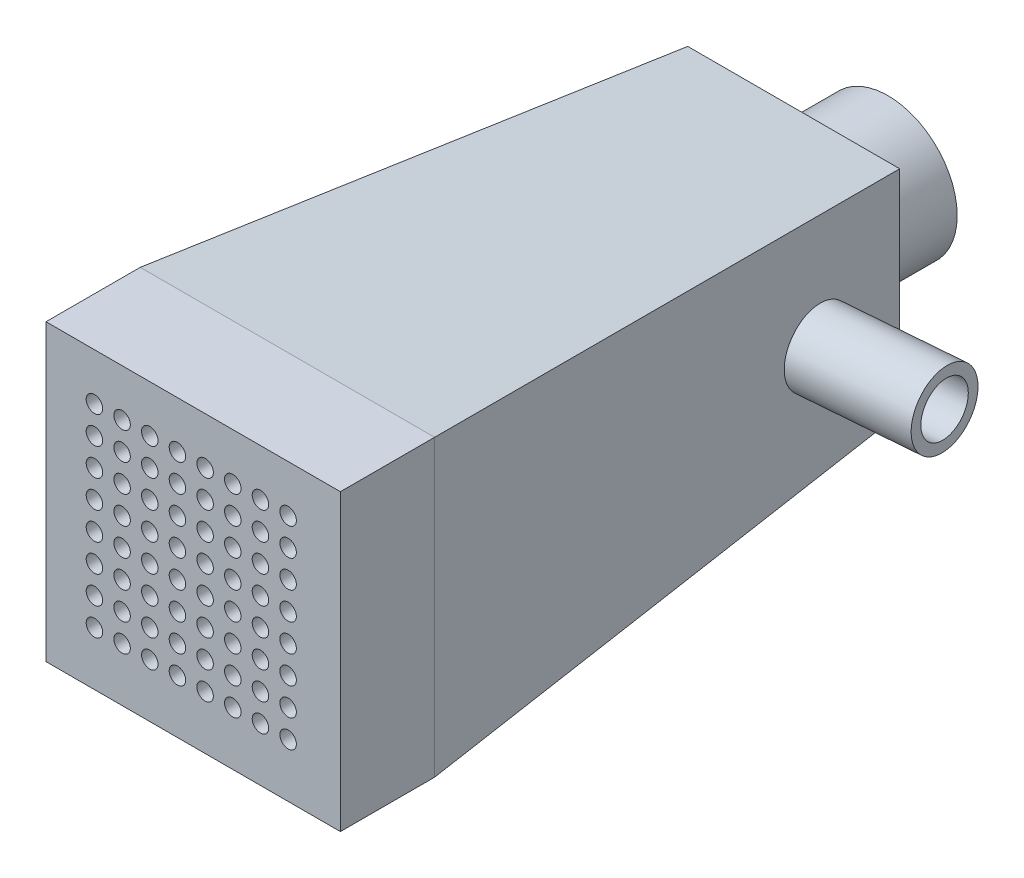
from build123d import *

# Parameters (mm, degrees)
SKETCH2_4_W         = 25
SKETCH2_4_H         = 25
BOSS_EXTRUDE2_DEPTH = 8
SKETCH5_R           = 0.7
CUT_EXTRUDE1_DEPTH  = 8
SKETCH6_R           = 3.1
SKETCH6_R_2         = 2.3
BOSS_EXTRUDE4_DEPTH = 10
CUT_EXTRUDE2_START  = -4
SKETCH6_4_R         = 2.3
CUT_EXTRUDE2_DEPTH  = 4
SKETCH9_R           = 3.1
SKETCH9_R_2         = 2.2
BOSS_EXTRUDE5_DEPTH = 10
SKETCH1_7_R         = 5.88
SKETCH1_7_R_2       = 4.38
BOSS_EXTRUDE7_DEPTH = 8
CUT_EXTRUDE3_START  = -20
SKETCH10_R          = 2.2
CUT_EXTRUDE3_DEPTH  = 20


with BuildPart() as part:
    # Sketch1 → Loft1 section 0
    with BuildSketch(Plane.XY):
        with BuildLine():
            Line((-9, 9), (9, 9))
            Line((9, 9), (9, -9))
            Line((9, -9), (-9, -9))
            Line((-9, -9), (-9, 9))
        make_face()
    # Sketch2 → Loft1 section 1
    with BuildSketch(Plane.XY.offset(43)):
        with BuildLine():
            Line((-12.5, 12.5), (12.5, 12.5))
            Line((12.5, 12.5), (12.5, -12.5))
            Line((12.5, -12.5), (-12.5, -12.5))
            Line((-12.5, -12.5), (-12.5, 12.5))
        make_face()
    loft()

    # Cut-Loft1: read off the stored shape, not the designer's step
    # Cut-Loft1: loft between two sections, ruled curve by curve
    cut_loft1_from = [
        Edge.make_bspline([(-3.097127702, -3.097127702, 0), (-2.732127702, -3.462127702, 0), (-2.271815958, -3.789394651, 0), (-1.207457606, -4.2500242, 0), (-0.604751801, -4.38, 0), (0.604751801, -4.38, 0), (1.207457606, -4.2500242, 0), (2.271815958, -3.789394651, 0), (2.732127702, -3.462127702, 0), (3.097127702, -3.097127702, 0)], [0, 0, 0, 0, 0.25, 0.25, 0.5, 0.5, 0.75, 0.75, 1, 1, 1, 1], 3),
        Edge.make_bspline([(3.097127702, -3.097127702, 0), (3.462127702, -2.732127702, 0), (3.789394651, -2.271815958, 0), (4.2500242, -1.207457606, 0), (4.38, -0.604751801, 0), (4.38, 0.604751801, 0), (4.2500242, 1.207457606, 0), (3.789394651, 2.271815958, 0), (3.462127702, 2.732127702, 0), (3.097127702, 3.097127702, 0)], [0, 0, 0, 0, 0.25, 0.25, 0.5, 0.5, 0.75, 0.75, 1, 1, 1, 1], 3),
        Edge.make_bspline([(-3.097127702, 3.097127702, 0), (-3.462127702, 2.732127702, 0), (-3.789394651, 2.271815958, 0), (-4.2500242, 1.207457606, 0), (-4.38, 0.604751801, 0), (-4.38, -0.604751801, 0), (-4.2500242, -1.207457606, 0), (-3.789394651, -2.271815958, 0), (-3.462127702, -2.732127702, 0), (-3.097127702, -3.097127702, 0)], [0, 0, 0, 0, 0.25, 0.25, 0.5, 0.5, 0.75, 0.75, 1, 1, 1, 1], 3),
        Edge.make_bspline([(3.097127702, 3.097127702, 0), (2.732127702, 3.462127702, 0), (2.271815958, 3.789394651, 0), (1.207457606, 4.2500242, 0), (0.604751801, 4.38, 0), (-0.604751801, 4.38, 0), (-1.207457606, 4.2500242, 0), (-2.271815958, 3.789394651, 0), (-2.732127702, 3.462127702, 0), (-3.097127702, 3.097127702, 0)], [0, 0, 0, 0, 0.25, 0.25, 0.5, 0.5, 0.75, 0.75, 1, 1, 1, 1], 3),
    ]
    cut_loft1_to = [
        Edge.make_bspline([(-10, -10, 43), (-8.333333333, -10, 43), (-6.666666667, -10, 43), (-3.333333333, -10, 43), (-1.666666667, -10, 43), (1.666666667, -10, 43), (3.333333333, -10, 43), (6.666666667, -10, 43), (8.333333333, -10, 43), (10, -10, 43)], [0, 0, 0, 0, 0.25, 0.25, 0.5, 0.5, 0.75, 0.75, 1, 1, 1, 1], 3),
        Edge.make_bspline([(10, -10, 43), (10, -8.333333333, 43), (10, -6.666666667, 43), (10, -3.333333333, 43), (10, -1.666666667, 43), (10, 1.666666667, 43), (10, 3.333333333, 43), (10, 6.666666667, 43), (10, 8.333333333, 43), (10, 10, 43)], [0, 0, 0, 0, 0.25, 0.25, 0.5, 0.5, 0.75, 0.75, 1, 1, 1, 1], 3),
        Edge.make_bspline([(-10, 10, 43), (-10, 8.333333333, 43), (-10, 6.666666667, 43), (-10, 3.333333333, 43), (-10, 1.666666667, 43), (-10, -1.666666667, 43), (-10, -3.333333333, 43), (-10, -6.666666667, 43), (-10, -8.333333333, 43), (-10, -10, 43)], [0, 0, 0, 0, 0.25, 0.25, 0.5, 0.5, 0.75, 0.75, 1, 1, 1, 1], 3),
        Edge.make_bspline([(10, 10, 43), (8.333333333, 10, 43), (6.666666667, 10, 43), (3.333333333, 10, 43), (1.666666667, 10, 43), (-1.666666667, 10, 43), (-3.333333333, 10, 43), (-6.666666667, 10, 43), (-8.333333333, 10, 43), (-10, 10, 43)], [0, 0, 0, 0, 0.25, 0.25, 0.5, 0.5, 0.75, 0.75, 1, 1, 1, 1], 3),
    ]
    cut_loft1 = Solid(Shell([*[Face.make_surface_from_curves(cut_loft1_from[k], cut_loft1_to[k]) for k in range(4)], Face(Wire(cut_loft1_from)), Face(Wire(cut_loft1_to))]))
    add(cut_loft1, mode=Mode.SUBTRACT)

    # Sketch2<4> → Boss-Extrude2 (add)
    with BuildSketch(Plane.XY.offset(43)):
        Rectangle(SKETCH2_4_W, SKETCH2_4_H)
    extrude(amount=BOSS_EXTRUDE2_DEPTH)

    # Sketch5 → Cut-Extrude1 (cut)
    with BuildSketch(Plane.XY.offset(43)):
        with Locations((-8.388056057, 8.509622087)):
            Circle(SKETCH5_R)
        with Locations((-6.038056057, 8.509622087)):
            Circle(SKETCH5_R)
        with Locations((-3.688056057, 8.509622087)):
            Circle(SKETCH5_R)
        with Locations((-1.338056057, 8.509622087)):
            Circle(SKETCH5_R)
        with Locations((1.011943943, 8.509622087)):
            Circle(SKETCH5_R)
        with Locations((3.361943943, 8.509622087)):
            Circle(SKETCH5_R)
        with Locations((5.711943943, 8.509622087)):
            Circle(SKETCH5_R)
        with Locations((8.061943943, 8.509622087)):
            Circle(SKETCH5_R)
        with Locations((-6.038056057, 6.159622087)):
            Circle(SKETCH5_R)
        with Locations((-3.688056057, 6.159622087)):
            Circle(SKETCH5_R)
        with Locations((-1.338056057, 6.159622087)):
            Circle(SKETCH5_R)
        with Locations((1.011943943, 6.159622087)):
            Circle(SKETCH5_R)
        with Locations((3.361943943, 6.159622087)):
            Circle(SKETCH5_R)
        with Locations((5.711943943, 6.159622087)):
            Circle(SKETCH5_R)
        with Locations((8.061943943, 6.159622087)):
            Circle(SKETCH5_R)
        with Locations((-6.038056057, 3.809622087)):
            Circle(SKETCH5_R)
        with Locations((-3.688056057, 3.809622087)):
            Circle(SKETCH5_R)
        with Locations((-1.338056057, 3.809622087)):
            Circle(SKETCH5_R)
        with Locations((1.011943943, 3.809622087)):
            Circle(SKETCH5_R)
        with Locations((3.361943943, 3.809622087)):
            Circle(SKETCH5_R)
        with Locations((5.711943943, 3.809622087)):
            Circle(SKETCH5_R)
        with Locations((8.061943943, 3.809622087)):
            Circle(SKETCH5_R)
        with Locations((-6.038056057, 1.459622087)):
            Circle(SKETCH5_R)
        with Locations((-3.688056057, 1.459622087)):
            Circle(SKETCH5_R)
        with Locations((-1.338056057, 1.459622087)):
            Circle(SKETCH5_R)
        with Locations((1.011943943, 1.459622087)):
            Circle(SKETCH5_R)
        with Locations((3.361943943, 1.459622087)):
            Circle(SKETCH5_R)
        with Locations((5.711943943, 1.459622087)):
            Circle(SKETCH5_R)
        with Locations((8.061943943, 1.459622087)):
            Circle(SKETCH5_R)
        with Locations((-6.038056057, -0.890377913)):
            Circle(SKETCH5_R)
        with Locations((-3.688056057, -0.890377913)):
            Circle(SKETCH5_R)
        with Locations((-1.338056057, -0.890377913)):
            Circle(SKETCH5_R)
        with Locations((1.011943943, -0.890377913)):
            Circle(SKETCH5_R)
        with Locations((3.361943943, -0.890377913)):
            Circle(SKETCH5_R)
        with Locations((5.711943943, -0.890377913)):
            Circle(SKETCH5_R)
        with Locations((8.061943943, -0.890377913)):
            Circle(SKETCH5_R)
        with Locations((-6.038056057, -3.240377913)):
            Circle(SKETCH5_R)
        with Locations((-3.688056057, -3.240377913)):
            Circle(SKETCH5_R)
        with Locations((-1.338056057, -3.240377913)):
            Circle(SKETCH5_R)
        with Locations((1.011943943, -3.240377913)):
            Circle(SKETCH5_R)
        with Locations((3.361943943, -3.240377913)):
            Circle(SKETCH5_R)
        with Locations((5.711943943, -3.240377913)):
            Circle(SKETCH5_R)
        with Locations((8.061943943, -3.240377913)):
            Circle(SKETCH5_R)
        with Locations((-6.038056057, -5.590377913)):
            Circle(SKETCH5_R)
        with Locations((-3.688056057, -5.590377913)):
            Circle(SKETCH5_R)
        with Locations((-1.338056057, -5.590377913)):
            Circle(SKETCH5_R)
        with Locations((1.011943943, -5.590377913)):
            Circle(SKETCH5_R)
        with Locations((3.361943943, -5.590377913)):
            Circle(SKETCH5_R)
        with Locations((5.711943943, -5.590377913)):
            Circle(SKETCH5_R)
        with Locations((8.061943943, -5.590377913)):
            Circle(SKETCH5_R)
        with Locations((-6.038056057, -7.940377913)):
            Circle(SKETCH5_R)
        with Locations((-3.688056057, -7.940377913)):
            Circle(SKETCH5_R)
        with Locations((-1.338056057, -7.940377913)):
            Circle(SKETCH5_R)
        with Locations((1.011943943, -7.940377913)):
            Circle(SKETCH5_R)
        with Locations((3.361943943, -7.940377913)):
            Circle(SKETCH5_R)
        with Locations((5.711943943, -7.940377913)):
            Circle(SKETCH5_R)
        with Locations((8.061943943, -7.940377913)):
            Circle(SKETCH5_R)
        with Locations((-8.388056057, 6.159622087)):
            Circle(SKETCH5_R)
        with Locations((-8.388056057, 3.809622087)):
            Circle(SKETCH5_R)
        with Locations((-8.388056057, 1.459622087)):
            Circle(SKETCH5_R)
        with Locations((-8.388056057, -0.890377913)):
            Circle(SKETCH5_R)
        with Locations((-8.388056057, -3.240377913)):
            Circle(SKETCH5_R)
        with Locations((-8.388056057, -5.590377913)):
            Circle(SKETCH5_R)
        with Locations((-8.388056057, -7.940377913)):
            Circle(SKETCH5_R)
    extrude(amount=CUT_EXTRUDE1_DEPTH, mode=Mode.SUBTRACT)

    # Sketch6 → Boss-Extrude4 (add)
    with BuildSketch(Plane(origin=(-8.940765615, 0, -0.727736736), x_dir=(-0.08112705090276601, 0, 0.9967037682339824), z_dir=(-0.9967037682339824, 0, -0.08112705090276602))):
        with Locations(Location((34.477535136, -1.520969622, 0), (0, 0, 180))):
            Circle(SKETCH6_R)
        with Locations((34.477535136, -1.520969622)):
            Circle(SKETCH6_R_2, mode=Mode.SUBTRACT)
    extrude(amount=BOSS_EXTRUDE4_DEPTH)

    # Sketch6<4> → Cut-Extrude2 (cut)
    with BuildSketch(Plane(origin=(-8.940765615, 0, -0.727736736), x_dir=(-0.08112705090276601, 0, 0.9967037682339824), z_dir=(-0.9967037682339824, 0, -0.08112705090276602)).offset(CUT_EXTRUDE2_START)):
        with Locations((34.477535136, -1.520969622)):
            Circle(SKETCH6_4_R)
    extrude(amount=CUT_EXTRUDE2_DEPTH, mode=Mode.SUBTRACT)

    # Sketch9 → Boss-Extrude5 (add)
    with BuildSketch(Plane(origin=(8.940765615, 0, -0.727736736), x_dir=(-0.08112705090276603, 0, -0.9967037682339824), z_dir=(0.9967037682339824, 0, -0.08112705090276605))):
        with Locations((-8.341303969, 0)):
            Circle(SKETCH9_R)
        with Locations((-8.341303969, 0)):
            Circle(SKETCH9_R_2, mode=Mode.SUBTRACT)
    extrude(amount=BOSS_EXTRUDE5_DEPTH)

    # Sketch1<7> → Boss-Extrude7 (add)
    with BuildSketch(Plane.XY):
        Circle(SKETCH1_7_R)
        Circle(SKETCH1_7_R_2, mode=Mode.SUBTRACT)
    extrude(amount=-BOSS_EXTRUDE7_DEPTH)

    # Sketch10 → Cut-Extrude3 (cut)
    with BuildSketch(Plane(origin=(18.907803297, 0, -1.539007245), x_dir=(-0.08112705090276605, 0, -0.9967037682339824), z_dir=(0.9967037682339824, 0, -0.08112705090276606)).offset(CUT_EXTRUDE3_START)):
        with Locations((-8.341303969, 0)):
            Circle(SKETCH10_R)
    extrude(amount=CUT_EXTRUDE3_DEPTH, mode=Mode.SUBTRACT)


solid = part.part
